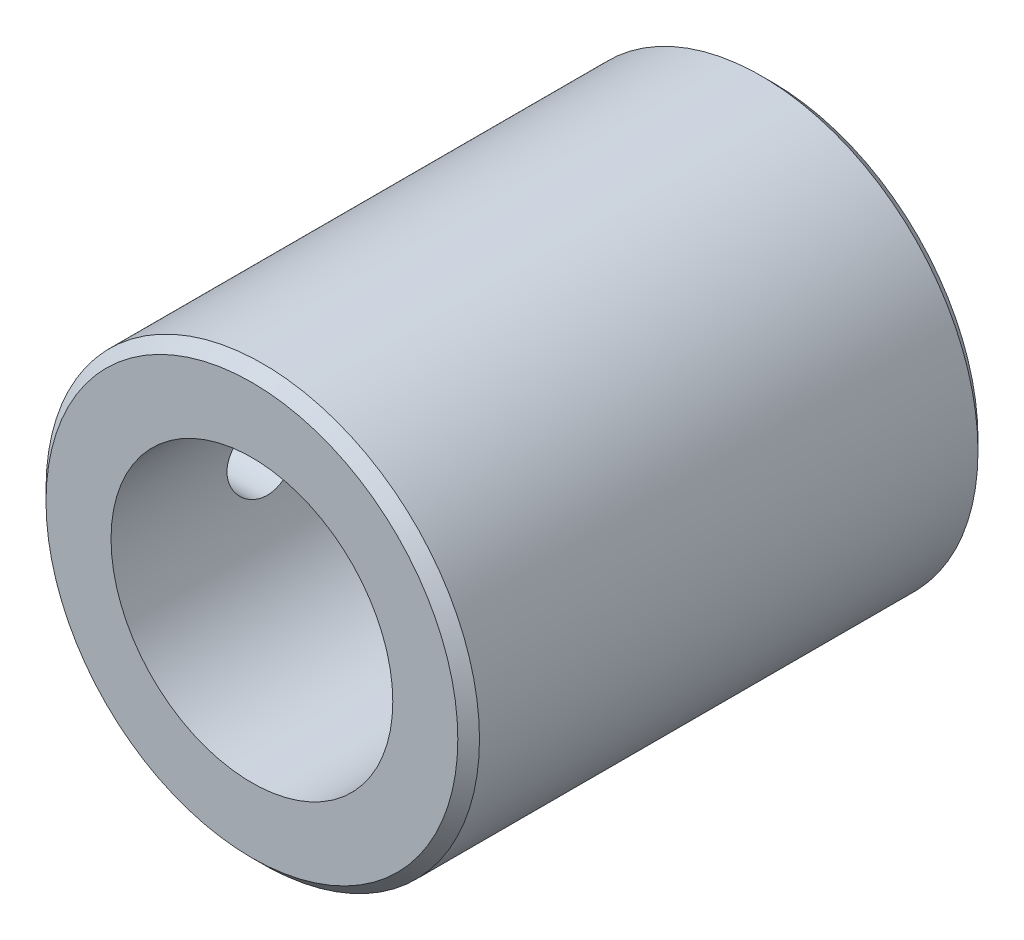
from build123d import *

# Parameters (mm, degrees)
SKETCH_1_R                  = 10
EXTRUDE_1_DEPTH             = 24
SKETCH_2_R                  = 6.5
CUT_EXTRUDE_1_DEPTH         = 15
M4X0_71_D                   = 3.3
M4X0_71_DEPTH               = 5
M4X0_71_TIP                 = 0.991420021
M3X0_51_OUTLINE_R           = 1.25
M3X0_51_DEPTH               = 9
HOLE_WIZARD_M31_D           = 3.4
HOLE_WIZARD_M31_CBORE_D     = 6.7
HOLE_WIZARD_M31_CBORE_DEPTH = 6
CHAMFER_1_SIZE              = 0.5


# Read off the part's stored shape, not the designer's step: Отверстие обработанное метчиком M3x0.51
with BuildPart() as part:
    # Эскиз1 → Бобышка-Вытянуть1 (new body)
    with BuildSketch(Plane.XY):
        Circle(SKETCH_1_R)
    extrude(amount=EXTRUDE_1_DEPTH)

    # Эскиз2 → Вырез-Вытянуть1 (cut)
    with BuildSketch(Plane.XY.offset(24)):
        Circle(SKETCH_2_R)
    extrude(amount=-CUT_EXTRUDE_1_DEPTH, mode=Mode.SUBTRACT)

    # Отверстие обработанное метчиком M4x0.71
    with Locations(Plane(origin=(-10, 0, 0), x_dir=(0, 0, -1), z_dir=(-1, 0, 0))):
        with Locations((-17, 0)):
            Hole(M4X0_71_D / 2, depth=M4X0_71_DEPTH)
            with Locations((0, 0, -(M4X0_71_DEPTH + M4X0_71_TIP / 2))):  # 118° drill point
                Cone(0, M4X0_71_D / 2, M4X0_71_TIP, mode=Mode.SUBTRACT)

    # Отверстие обработанное метчиком M3x0.51 outline → Отверстие обработанное метчиком M3x0.51 (cut)
    with BuildSketch(Plane.XY):
        with Locations((4.242640687, -4.242640687)):
            Circle(M3X0_51_OUTLINE_R)
        with Locations((-4.242640687, -4.242640687)):
            Circle(M3X0_51_OUTLINE_R)
        with Locations((-4.242640687, 4.242640687)):
            Circle(M3X0_51_OUTLINE_R)
        with Locations((4.242640687, 4.242640687)):
            Circle(M3X0_51_OUTLINE_R)
    extrude(amount=M3X0_51_DEPTH, mode=Mode.SUBTRACT)

    # Цековка для  винта с полукруглой головкой M31 (through all)
    with Locations(Plane(origin=(0, 0, 0), x_dir=(-1, 0, 0), z_dir=(0, 0, -1))):
        with Locations((0, 0)):
            CounterBoreHole(HOLE_WIZARD_M31_D / 2, HOLE_WIZARD_M31_CBORE_D / 2, HOLE_WIZARD_M31_CBORE_DEPTH)

    # Фаска1
    chamfer_1_edges = [part.edges().sort_by_distance(p)[0] for p in [
        (-10, 0, 0),
        (-10, 0, 24),
    ]]
    chamfer(chamfer_1_edges, length=CHAMFER_1_SIZE)


solid = part.part
